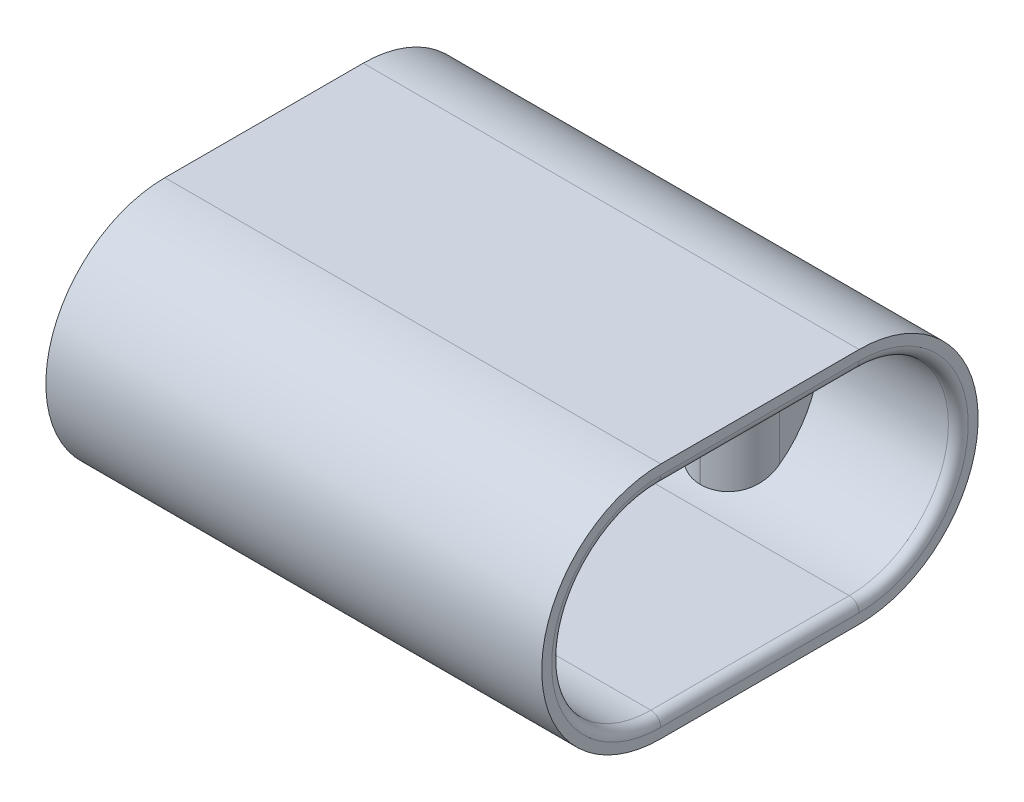
from build123d import *

# Parameters (mm, degrees)
FILLET1_R                       = 0.5
BOSS_EXTRUDE6_REACH             = 29.964
BOSS_EXTRUDE6_DIRECTION_2_REACH = 29.964
MIRROR2_COPY_1_REACH            = 29.964
MIRROR2_COPY_2_REACH            = 29.964
MIRROR2_COPY_3_REACH            = 29.964
MIRROR2_COPY_4_REACH            = 29.964


with BuildPart() as part:
    # Sweep1: sweep along a path in Sketch2path
    with BuildLine(Plane.XY) as sweep1_path:
        Line((0, 0), (25, 0))
    # Sketch3 → Sweep1 (sweep)
    with BuildSketch(Plane(origin=(0, 0, 0), x_dir=(0, 0, -1), z_dir=(1, 0, 0))):
        with BuildLine():
            Line((-5, 6), (5, 6))
            ThreePointArc((5, 6), (11, 0), (5, -6))
            Line((5, -6), (-5, -6))
            ThreePointArc((-5, -6), (-11, 0), (-5, 6))
        make_face()
        with BuildLine():
            Line((-5, 5), (5, 5))
            ThreePointArc((5, 5), (10, 0), (5, -5))
            Line((5, -5), (-5, -5))
            ThreePointArc((-5, -5), (-10, 0), (-5, 5))
        make_face(mode=Mode.SUBTRACT)
    sweep(path=sweep1_path.line)

    # Fillet1
    fillet1_edges = [part.edges().sort_by_distance(p)[0] for p in [
        (25, 0, -10),
        (25, -5, 0),
        (25, 0, 10),
        (0, 0, 10),
        (0, 5, 0),
        (0, 0, -10),
        (25, 5, 0),
        (0, -5, 0),
    ]]
    fillet(fillet1_edges, radius=FILLET1_R)

    # Sketch13 → Boss-Extrude6 (add, up to next)
    with BuildSketch(Plane(origin=(0, 0, 0), x_dir=(1, 0, 0), z_dir=(0, 1, 0)), mode=Mode.PRIVATE) as boss_extrude6_sk1:
        with BuildLine():
            Line((15.99, -6), (16.01, -6))
            ThreePointArc((16.01, -6), (17.417142495, -6.582857505), (18, -7.99))
            Line((18, -7.99), (18, -10))
            Line((18, -10), (14, -10))
            Line((14, -10), (14, -7.99))
            ThreePointArc((14, -7.99), (14.582857505, -6.582857505), (15.99, -6))
        make_face()
    boss_extrude6_tool1 = extrude(boss_extrude6_sk1.sketch, amount=BOSS_EXTRUDE6_REACH, mode=Mode.PRIVATE) - part.part
    boss_extrude6 = boss_extrude6_tool1.solids().sort_by_distance((16, 0, 8.184882))[0]
    add(boss_extrude6)

    # Sketch13 → Boss-Extrude6 direction 2 (add, up to next)
    with BuildSketch(Plane(origin=(0, 0, 0), x_dir=(1, 0, 0), z_dir=(0, 1, 0)), mode=Mode.PRIVATE) as boss_extrude6_direction_2_sk1:
        with BuildLine():
            Line((15.99, -6), (16.01, -6))
            ThreePointArc((16.01, -6), (17.417142495, -6.582857505), (18, -7.99))
            Line((18, -7.99), (18, -10))
            Line((18, -10), (14, -10))
            Line((14, -10), (14, -7.99))
            ThreePointArc((14, -7.99), (14.582857505, -6.582857505), (15.99, -6))
        make_face()
    boss_extrude6_direction_2_tool1 = extrude(boss_extrude6_direction_2_sk1.sketch, amount=-BOSS_EXTRUDE6_DIRECTION_2_REACH, mode=Mode.PRIVATE) - part.part
    boss_extrude6_direction_2 = boss_extrude6_direction_2_tool1.solids().sort_by_distance((16, 0, 8.184882))[0]
    add(boss_extrude6_direction_2)

    # Mirror1: Boss-Extrude6, Boss-Extrude6 direction 2 across plane
    add(boss_extrude6.mirror(Plane(origin=(12.5, 0, 0), x_dir=(0, 0, 1), z_dir=(1, 0, 0))))
    add(boss_extrude6_direction_2.mirror(Plane(origin=(12.5, 0, 0), x_dir=(0, 0, 1), z_dir=(1, 0, 0))))

    # Mirror2 copy 1 sketch → Mirror2 copy 1 (add, up to next)
    with BuildSketch(Plane(origin=(25, 0, 0), x_dir=(-1, 0, 0), z_dir=(0, 1, 0)), mode=Mode.PRIVATE) as mirror2_copy_1_sk1:
        with BuildLine():
            Line((15.99, -6), (16.01, -6))
            ThreePointArc((16.01, -6), (17.417142495, -6.582857505), (18, -7.99))
            Line((18, -7.99), (18, -10))
            Line((18, -10), (14, -10))
            Line((14, -10), (14, -7.99))
            ThreePointArc((14, -7.99), (14.582857505, -6.582857505), (15.99, -6))
        make_face()
    mirror2_copy_1_tool1 = extrude(mirror2_copy_1_sk1.sketch, amount=MIRROR2_COPY_1_REACH, mode=Mode.PRIVATE) - part.part
    add(mirror2_copy_1_tool1.solids().sort_by_distance((9, 0, -8.184882))[0])

    # Mirror2 copy 2 sketch → Mirror2 copy 2 (add, up to next)
    with BuildSketch(Plane(origin=(25, 0, 0), x_dir=(-1, 0, 0), z_dir=(0, 1, 0)), mode=Mode.PRIVATE) as mirror2_copy_2_sk1:
        with BuildLine():
            Line((15.99, -6), (16.01, -6))
            ThreePointArc((16.01, -6), (17.417142495, -6.582857505), (18, -7.99))
            Line((18, -7.99), (18, -10))
            Line((18, -10), (14, -10))
            Line((14, -10), (14, -7.99))
            ThreePointArc((14, -7.99), (14.582857505, -6.582857505), (15.99, -6))
        make_face()
    mirror2_copy_2_tool1 = extrude(mirror2_copy_2_sk1.sketch, amount=-MIRROR2_COPY_2_REACH, mode=Mode.PRIVATE) - part.part
    add(mirror2_copy_2_tool1.solids().sort_by_distance((9, 0, -8.184882))[0])

    # Mirror2 copy 3 sketch → Mirror2 copy 3 (add, up to next)
    with BuildSketch(Plane(origin=(0, 0, 0), x_dir=(1, 0, 0), z_dir=(0, 1, 0)), mode=Mode.PRIVATE) as mirror2_copy_3_sk1:
        with BuildLine():
            Line((15.99, 6), (16.01, 6))
            ThreePointArc((16.01, 6), (17.417142495, 6.582857505), (18, 7.99))
            Line((18, 7.99), (18, 10))
            Line((18, 10), (14, 10))
            Line((14, 10), (14, 7.99))
            ThreePointArc((14, 7.99), (14.582857505, 6.582857505), (15.99, 6))
        make_face()
    mirror2_copy_3_tool1 = extrude(mirror2_copy_3_sk1.sketch, amount=MIRROR2_COPY_3_REACH, mode=Mode.PRIVATE) - part.part
    add(mirror2_copy_3_tool1.solids().sort_by_distance((16, 0, -8.184882))[0])

    # Mirror2 copy 4 sketch → Mirror2 copy 4 (add, up to next)
    with BuildSketch(Plane(origin=(0, 0, 0), x_dir=(1, 0, 0), z_dir=(0, 1, 0)), mode=Mode.PRIVATE) as mirror2_copy_4_sk1:
        with BuildLine():
            Line((15.99, 6), (16.01, 6))
            ThreePointArc((16.01, 6), (17.417142495, 6.582857505), (18, 7.99))
            Line((18, 7.99), (18, 10))
            Line((18, 10), (14, 10))
            Line((14, 10), (14, 7.99))
            ThreePointArc((14, 7.99), (14.582857505, 6.582857505), (15.99, 6))
        make_face()
    mirror2_copy_4_tool1 = extrude(mirror2_copy_4_sk1.sketch, amount=-MIRROR2_COPY_4_REACH, mode=Mode.PRIVATE) - part.part
    add(mirror2_copy_4_tool1.solids().sort_by_distance((16, 0, -8.184882))[0])


solid = part.part
